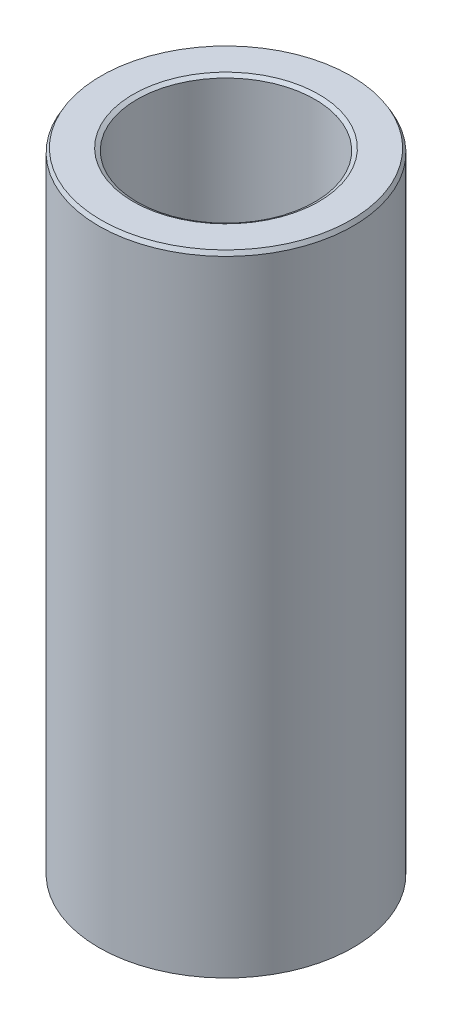
from build123d import *
from OCP.BRepFilletAPI import BRepFilletAPI_MakeChamfer

# Parameters (mm, degrees)
SKETCH1_R           = 17.5
BOSS_EXTRUDE1_DEPTH = 86.830405002
SKETCH2_R           = 12.231998411
CUT_EXTRUDE1_DEPTH  = 91.28853323
CHAMFER1_SIZE       = 0.54934196
CHAMFER1_SIZE2      = 0.317162728


with BuildPart() as part:
    # Sketch1 → Boss-Extrude1 (new body)
    with BuildSketch(Plane(origin=(0, 0, 0), x_dir=(1, 0, 0), z_dir=(0, 1, 0))):
        Circle(SKETCH1_R)
    extrude(amount=BOSS_EXTRUDE1_DEPTH)

    # Sketch2 → Cut-Extrude1 (cut, through all)
    with BuildSketch(Plane(origin=(0, 0, 0), x_dir=(1, 0, 0), z_dir=(0, 1, 0))):
        Circle(SKETCH2_R)
    extrude(amount=CUT_EXTRUDE1_DEPTH, mode=Mode.SUBTRACT)

    # Chamfer1: one chamfer whose edges measure the first distance from different faces: ONE call of the kernel's chamfer builder (chamfer() names one face for all edges)
    chamfer1_edges_1 = [part.edges().sort_by_distance(p)[0] for p in [
        (-12.231998411, 86.830405002, 0),
    ]]
    chamfer1_side_1 = [part.faces().sort_by_distance(p)[0] for p in [
        (-17.005025253, 86.830405002, 0),
    ]]
    chamfer1_edges_2 = [part.edges().sort_by_distance(p)[0] for p in [
        (-12.231998411, 0, 0),
    ]]
    chamfer1_side_2 = [part.faces().sort_by_distance(p)[0] for p in [
        (-12.231998411, 43.415202501, 0),
    ]]
    chamfer1_edges_3 = [part.edges().sort_by_distance(p)[0] for p in [
        (-17.5, 0, 0),
    ]]
    chamfer1_side_3 = [part.faces().sort_by_distance(p)[0] for p in [
        (-17.005025253, 0, 0),
    ]]
    chamfer1_edges_4 = [part.edges().sort_by_distance(p)[0] for p in [
        (-17.5, 86.830405002, 0),
    ]]
    chamfer1_side_4 = [part.faces().sort_by_distance(p)[0] for p in [
        (-17.5, 43.415202501, 0),
    ]]
    chamfer1 = BRepFilletAPI_MakeChamfer(part.part.solid().wrapped)
    for e in chamfer1_edges_1:
        chamfer1.Add(CHAMFER1_SIZE, CHAMFER1_SIZE2, e.wrapped, chamfer1_side_1[0].wrapped)  # the first distance lies on this face
    for e in chamfer1_edges_2:
        chamfer1.Add(CHAMFER1_SIZE, CHAMFER1_SIZE2, e.wrapped, chamfer1_side_2[0].wrapped)  # the first distance lies on this face
    for e in chamfer1_edges_3:
        chamfer1.Add(CHAMFER1_SIZE, CHAMFER1_SIZE2, e.wrapped, chamfer1_side_3[0].wrapped)  # the first distance lies on this face
    for e in chamfer1_edges_4:
        chamfer1.Add(CHAMFER1_SIZE, CHAMFER1_SIZE2, e.wrapped, chamfer1_side_4[0].wrapped)  # the first distance lies on this face
    add(Compound.cast(chamfer1.Shape()), mode=Mode.REPLACE)


solid = part.part
